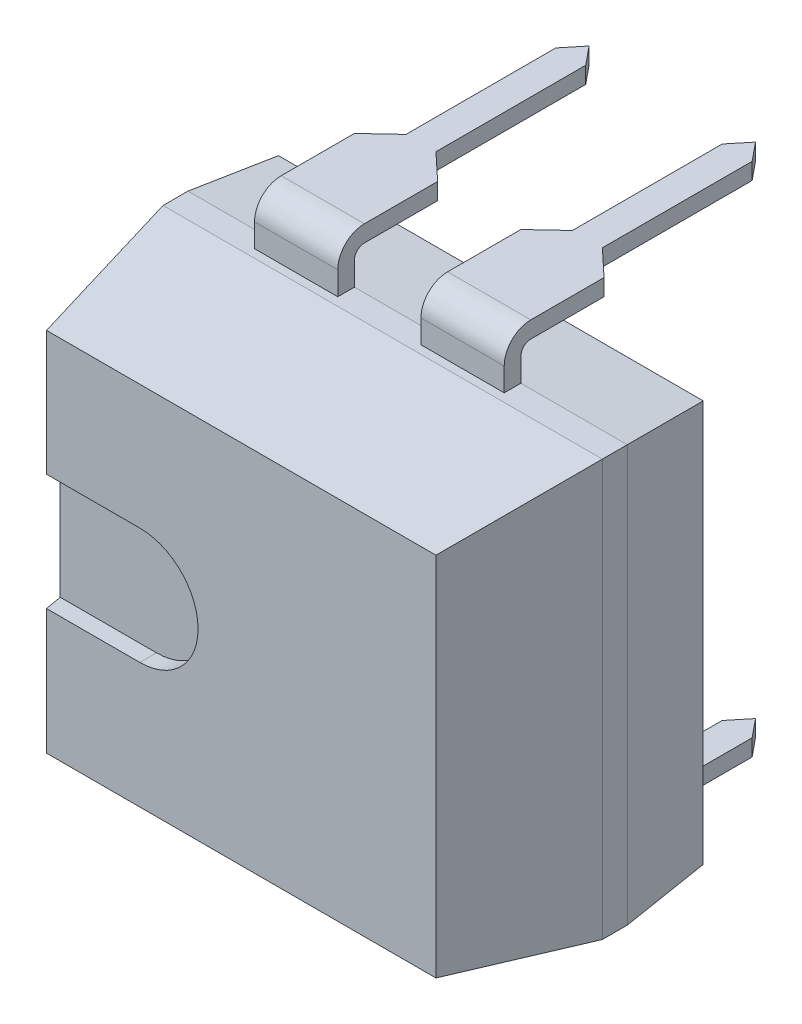
from build123d import *
from OCP.BRepFilletAPI import BRepFilletAPI_MakeChamfer

# Parameters (mm, degrees)
SKETCH1_W                = 6.705
SKETCH1_H                = 6.35
BASE_EXTRUDE_DEPTH       = 3.81
CHAMFER1_SIZE            = 2.159
CHAMFER1_SIZE2           = 0.380689951
CHAMFER2_SIZE            = 1.27
CHAMFER2_SIZE2           = 0.111110603
CUT_EXTRUDE1_START       = 3.937
CUT_EXTRUDE1_DEPTH       = 0.254
BOSS_EXTRUDE_THIN3_DEPTH = 0.635
CUT_EXTRUDE3_DEPTH       = 10.549085035
CUT_EXTRUDE4_DEPTH       = 10.549085035
LPATTERN2_COUNT          = 2
LPATTERN2_PITCH          = 2.54
MIRROR1_COPY_1_DEPTH     = 0.635
MIRROR1_COPY_2_DEPTH     = 10.549085035
MIRROR1_COPY_3_DEPTH     = 10.549085035


# Read off the part's stored shape, not the designer's step: Cut-Extrude1
with BuildPart() as part:
    # Sketch1 → Base-Extrude (new body)
    with BuildSketch(Plane.XY.offset(0.381)):
        with Locations((1.4475, 3.937)):
            Rectangle(SKETCH1_W, SKETCH1_H)
    extrude(amount=BASE_EXTRUDE_DEPTH)

    # Chamfer1: one chamfer whose edges measure the first distance from different faces: ONE call of the kernel's chamfer builder (chamfer() names one face for all edges)
    chamfer1_edges_1 = [part.edges().sort_by_distance(p)[0] for p in [
        (4.8, 3.937, 4.191),
    ]]
    chamfer1_side_1 = [part.faces().sort_by_distance(p)[0] for p in [
        (4.8, 3.937, 2.286),
    ]]
    chamfer1_edges_2 = [part.edges().sort_by_distance(p)[0] for p in [
        (1.4475, 7.112, 4.191),
    ]]
    chamfer1_side_2 = [part.faces().sort_by_distance(p)[0] for p in [
        (1.4475, 7.112, 2.286),
    ]]
    chamfer1_edges_3 = [part.edges().sort_by_distance(p)[0] for p in [
        (-1.905, 3.937, 4.191),
    ]]
    chamfer1_side_3 = [part.faces().sort_by_distance(p)[0] for p in [
        (-1.905, 3.937, 2.286),
    ]]
    chamfer1_edges_4 = [part.edges().sort_by_distance(p)[0] for p in [
        (1.4475, 0.762, 4.191),
    ]]
    chamfer1_side_4 = [part.faces().sort_by_distance(p)[0] for p in [
        (1.4475, 0.762, 2.286),
    ]]
    chamfer1 = BRepFilletAPI_MakeChamfer(part.part.solid().wrapped)
    for e in chamfer1_edges_1:
        chamfer1.Add(CHAMFER1_SIZE, CHAMFER1_SIZE2, e.wrapped, chamfer1_side_1[0].wrapped)  # the first distance lies on this face
    for e in chamfer1_edges_2:
        chamfer1.Add(CHAMFER1_SIZE, CHAMFER1_SIZE2, e.wrapped, chamfer1_side_2[0].wrapped)  # the first distance lies on this face
    for e in chamfer1_edges_3:
        chamfer1.Add(CHAMFER1_SIZE, CHAMFER1_SIZE2, e.wrapped, chamfer1_side_3[0].wrapped)  # the first distance lies on this face
    for e in chamfer1_edges_4:
        chamfer1.Add(CHAMFER1_SIZE, CHAMFER1_SIZE2, e.wrapped, chamfer1_side_4[0].wrapped)  # the first distance lies on this face
    add(Compound.cast(chamfer1.Shape()), mode=Mode.REPLACE)

    # Chamfer2: one chamfer whose edges measure the first distance from different faces: ONE call of the kernel's chamfer builder (chamfer() names one face for all edges)
    chamfer2_edges_1 = [part.edges().sort_by_distance(p)[0] for p in [
        (1.4475, 7.112, 0.381),
    ]]
    chamfer2_side_1 = [part.faces().sort_by_distance(p)[0] for p in [
        (1.4475, 7.112, 1.2065),
    ]]
    chamfer2_edges_2 = [part.edges().sort_by_distance(p)[0] for p in [
        (4.8, 3.937, 0.381),
    ]]
    chamfer2_side_2 = [part.faces().sort_by_distance(p)[0] for p in [
        (4.8, 3.937, 1.2065),
    ]]
    chamfer2_edges_3 = [part.edges().sort_by_distance(p)[0] for p in [
        (1.4475, 0.762, 0.381),
    ]]
    chamfer2_side_3 = [part.faces().sort_by_distance(p)[0] for p in [
        (1.4475, 0.762, 1.2065),
    ]]
    chamfer2_edges_4 = [part.edges().sort_by_distance(p)[0] for p in [
        (-1.905, 3.937, 0.381),
    ]]
    chamfer2_side_4 = [part.faces().sort_by_distance(p)[0] for p in [
        (-1.905, 3.937, 1.2065),
    ]]
    chamfer2 = BRepFilletAPI_MakeChamfer(part.part.solid().wrapped)
    for e in chamfer2_edges_1:
        chamfer2.Add(CHAMFER2_SIZE, CHAMFER2_SIZE2, e.wrapped, chamfer2_side_1[0].wrapped)  # the first distance lies on this face
    for e in chamfer2_edges_2:
        chamfer2.Add(CHAMFER2_SIZE, CHAMFER2_SIZE2, e.wrapped, chamfer2_side_2[0].wrapped)  # the first distance lies on this face
    for e in chamfer2_edges_3:
        chamfer2.Add(CHAMFER2_SIZE, CHAMFER2_SIZE2, e.wrapped, chamfer2_side_3[0].wrapped)  # the first distance lies on this face
    for e in chamfer2_edges_4:
        chamfer2.Add(CHAMFER2_SIZE, CHAMFER2_SIZE2, e.wrapped, chamfer2_side_4[0].wrapped)  # the first distance lies on this face
    add(Compound.cast(chamfer2.Shape()), mode=Mode.REPLACE)

    # Cut-Extrude1 outline → Cut-Extrude1 (cut)
    with BuildSketch(Plane.XY.offset(CUT_EXTRUDE1_START)):
        with BuildLine():
            Line((-0.099439262, 4.829907029), (-3, 4.829907029))
            Line((-3, 4.829907029), (-3, 3.054205915))
            Line((-3, 3.054205915), (-0.099439262, 3.054205915))
            ThreePointArc((-0.099439262, 3.054205915), (0.788411294, 3.942056472), (-0.099439262, 4.829907029))
        make_face()
    extrude(amount=CUT_EXTRUDE1_DEPTH, mode=Mode.SUBTRACT)

    # Sketch4 → Boss-Extrude-Thin3 (add, symmetric)
    with BuildSketch(Plane(origin=(0, 0, 0), x_dir=(0, 0, -1), z_dir=(1, 0, 0))):
        with BuildLine():
            Line((2.5654, 0), (-1.4986, 0))
            ThreePointArc((-1.4986, 0), (-1.785968196, 0.119031804), (-1.905, 0.4064))
            Line((-1.905, 0.4064), (-1.905, 1.120296425))
            Line((-1.905, 1.120296425), (-1.651, 1.120296425))
            Line((-1.651, 1.120296425), (-1.651, 0.4064))
            ThreePointArc((-1.651, 0.4064), (-1.606363073, 0.298636927), (-1.4986, 0.254))
            Line((-1.4986, 0.254), (2.5654, 0.254))
            Line((2.5654, 0.254), (2.5654, 0))
        make_face()
    boss_extrude_thin3 = extrude(amount=BOSS_EXTRUDE_THIN3_DEPTH, both=True)

    # Sketch8 → Cut-Extrude3 (cut, through all)
    with BuildSketch(Plane.XZ):
        Polygon((-0.635, 0.381), (-0.2286, 0), (-0.2286, -2.286), (0, -2.5654), (-0.635, -2.5654), align=None)
    cut_extrude3 = extrude(amount=-CUT_EXTRUDE3_DEPTH, mode=Mode.SUBTRACT)

    # Sketch9 → Cut-Extrude4 (cut, through all)
    with BuildSketch(Plane.XZ):
        Polygon((0.635, 0.381), (0.2286, 0), (0.2286, -2.286), (0, -2.5654), (0.635, -2.5654), align=None)
    cut_extrude4 = extrude(amount=-CUT_EXTRUDE4_DEPTH, mode=Mode.SUBTRACT)

    # LPattern2: Boss-Extrude-Thin3, Cut-Extrude3, Cut-Extrude4 ×2
    with Locations(*[(i * LPATTERN2_PITCH, 0, 0) for i in range(1, LPATTERN2_COUNT)]):
        add(boss_extrude_thin3)
        add(cut_extrude3, mode=Mode.SUBTRACT)
        add(cut_extrude4, mode=Mode.SUBTRACT)

    # Mirror1: Boss-Extrude-Thin3, Cut-Extrude3, Cut-Extrude4 across plane
    add(boss_extrude_thin3.mirror(Plane.ZX.offset(3.937)))
    add(cut_extrude3.mirror(Plane.ZX.offset(3.937)), mode=Mode.SUBTRACT)
    add(cut_extrude4.mirror(Plane.ZX.offset(3.937)), mode=Mode.SUBTRACT)

    # Mirror1 copy 1 sketch → Mirror1 copy 1 (add, symmetric)
    with BuildSketch(Plane(origin=(2.54, 7.874, 0), x_dir=(0, 0, -1), z_dir=(1, 0, 0))):
        with BuildLine():
            Line((2.5654, 0), (-1.4986, 0))
            ThreePointArc((-1.4986, 0), (-1.785968196, -0.119031804), (-1.905, -0.4064))
            Line((-1.905, -0.4064), (-1.905, -1.120296425))
            Line((-1.905, -1.120296425), (-1.651, -1.120296425))
            Line((-1.651, -1.120296425), (-1.651, -0.4064))
            ThreePointArc((-1.651, -0.4064), (-1.606363073, -0.298636927), (-1.4986, -0.254))
            Line((-1.4986, -0.254), (2.5654, -0.254))
            Line((2.5654, -0.254), (2.5654, 0))
        make_face()
    extrude(amount=MIRROR1_COPY_1_DEPTH, both=True)

    # Mirror1 copy 2 sketch → Mirror1 copy 2 (cut, through all)
    with BuildSketch(Plane(origin=(2.54, 7.874, 0), x_dir=(1, 0, 0), z_dir=(0, 1, 0))):
        Polygon((-0.635, -0.381), (-0.2286, 0), (-0.2286, 2.286), (0, 2.5654), (-0.635, 2.5654), align=None)
    extrude(amount=-MIRROR1_COPY_2_DEPTH, mode=Mode.SUBTRACT)

    # Mirror1 copy 3 sketch → Mirror1 copy 3 (cut, through all)
    with BuildSketch(Plane(origin=(2.54, 7.874, 0), x_dir=(1, 0, 0), z_dir=(0, 1, 0))):
        Polygon((0.635, -0.381), (0.2286, 0), (0.2286, 2.286), (0, 2.5654), (0.635, 2.5654), align=None)
    extrude(amount=-MIRROR1_COPY_3_DEPTH, mode=Mode.SUBTRACT)


solid = part.part
